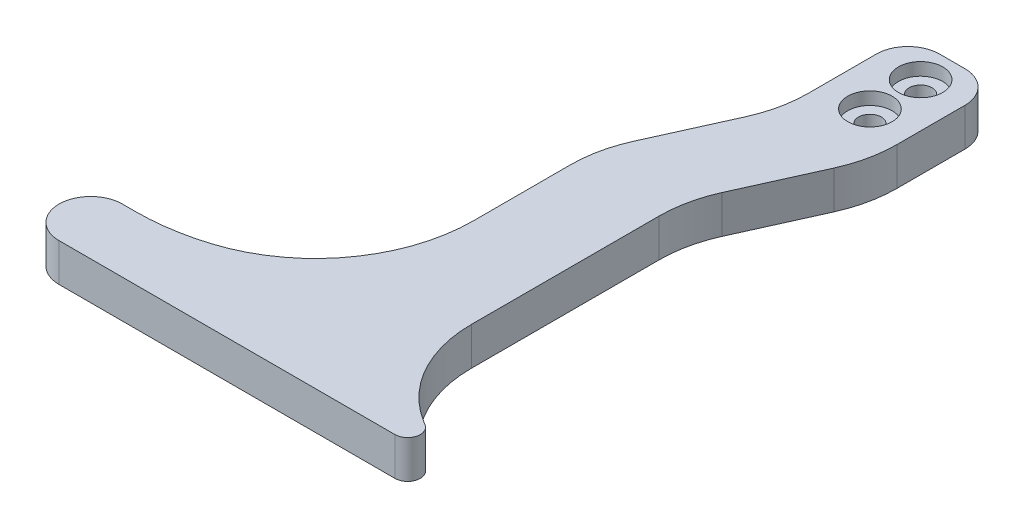
from build123d import *

# Parameters (mm, degrees)
SKETCH1_R           = 2.286
BOSS_EXTRUDE1_DEPTH = 7.62
FILLET1_R           = 25.4
FILLET3_R           = 44.45
FILLET2_R           = 6.35
FILLET4_R           = 31.75
SKETCH3_R           = 4.445
CUT_EXTRUDE1_DEPTH  = 2.54
FILLET5_R           = 2.54


# Some blends are built 0.0001 mm under size
with BuildPart() as part:
    # Sketch1 → Boss-Extrude1 (new body)
    with BuildSketch(Plane(origin=(0, 0, 0), x_dir=(1, 0, 0), z_dir=(0, 1, 0))):
        Polygon((0, 0), (17.78, 0), (17.78, -25.4), (6.35, -50.8), (6.35, -107.95), (26.67, -120.65), (-55.88, -120.65), (-55.88, -107.95), (-5.08, -107.95), (-11.43, -90.17), (-11.43, -50.8), (0, -25.4), align=None)
        with Locations(Location((8.89, -6.35, 0), (0, 0, 270))):
            Circle(SKETCH1_R, mode=Mode.SUBTRACT)
        with Locations(Location((8.89, -16.51, 0), (0, 0, 270))):
            Circle(SKETCH1_R, mode=Mode.SUBTRACT)
    extrude(amount=BOSS_EXTRUDE1_DEPTH)

    # Fillet1
    fillet1_edges = [part.edges().sort_by_distance(p)[0] for p in [
        (17.78, 3.81, 25.4),
        (6.35, 3.81, 50.8),
        (6.35, 3.81, 107.95),
        (-11.43, 3.81, 50.8),
        (0, 3.81, 25.4),
    ]]
    fillet(fillet1_edges, radius=FILLET1_R)

    # Fillet3
    # the kernel refuses this fillet: 44.45 mm, written as the material it adds along each edge
    with BuildSketch(Plane(origin=(-5.08, 0, 107.95), x_dir=(-0.3363363969981565, 0, -0.9417419115948374), z_dir=(0, 1, 0))) as fillet3_piece_1:
        with BuildLine():
            CenterArc((55.956286369, 24.518250668), FILLET3_R, 160.346175942, 53.130102354)
            Line((14.095858398, 39.468403515), (13.258649839, 39.767406572))
            Line((13.258649839, 39.767406572), (-0.837208559, 0.299003057))
            Line((-0.837208559, 0.299003057), (0, -0.889))
            ThreePointArc((0, -0.889), (9.439953655, -0.889), (18.138379728, -0.490365013))
            Line((18.138379728, -0.490365013), (18.879907309, 0))
        make_face()
    extrude(amount=7.62)

    # Fillet2
    fillet2_edges = [part.edges().sort_by_distance(p)[0] for p in [
        (17.78, 3.81, 0),
        (0, 3.81, 0),
        (-55.88, 3.81, 120.65),
        (-55.88, 3.81, 107.95),
    ]]
    fillet(fillet2_edges, radius=FILLET2_R - 0.0001)  # a hair under: the kernel refuses the full size

    # Fillet4
    fillet4_edges = [part.edges().sort_by_distance(p)[0] for p in [
        (-11.43, 3.81, 90.17),
    ]]
    fillet(fillet4_edges, radius=FILLET4_R)

    # Sketch3 → Cut-Extrude1 (cut)
    with BuildSketch(Plane(origin=(0, 7.62, 0), x_dir=(1, 0, 0), z_dir=(0, 1, 0))):
        with Locations(Location((8.89, -6.35, 0), (0, 0, 270))):
            Circle(SKETCH3_R)
        with Locations(Location((8.89, -16.51, 0), (0, 0, 270))):
            Circle(SKETCH3_R)
    extrude(amount=-CUT_EXTRUDE1_DEPTH, mode=Mode.SUBTRACT)

    # Fillet5
    fillet5_edges = [part.edges().sort_by_distance(p)[0] for p in [
        (26.67, 3.81, 120.65),
    ]]
    fillet(fillet5_edges, radius=FILLET5_R)


solid = part.part
